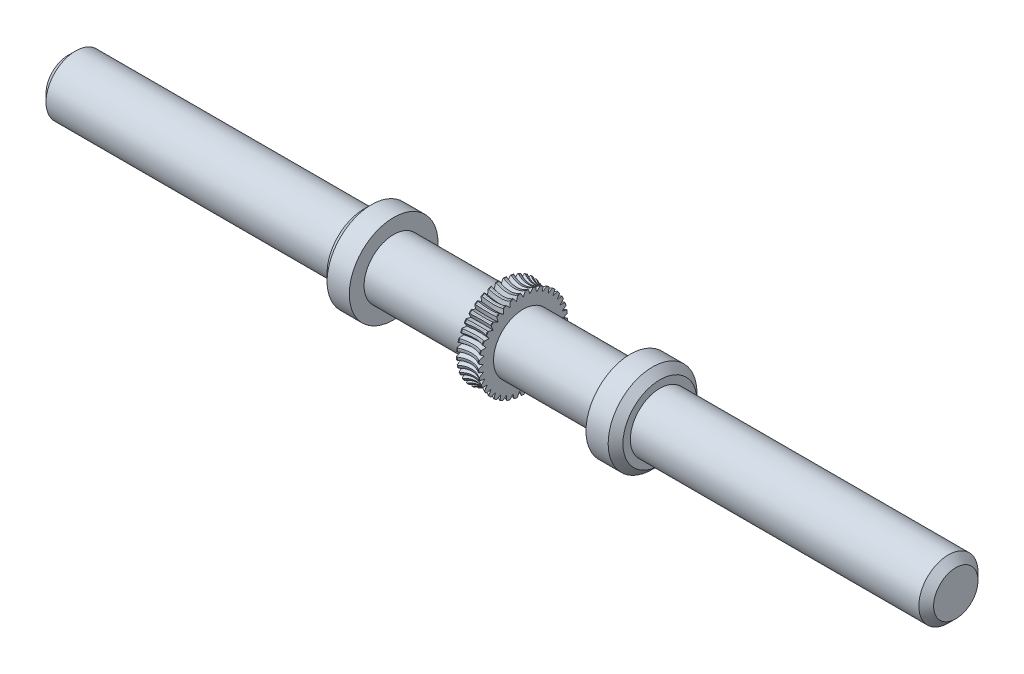
from build123d import *

# Parameters (mm, degrees)
CHAMFER1_SIZE     = 0.5
CIRPATTERN1_COUNT = 37
SKETCH3_W         = 7.25
SKETCH3_H         = 1


with BuildPart() as part:
    # Sketch1 → Revolve1 (revolve)
    with BuildSketch(Plane.XY):
        Polygon((-10, 3), (10, 3), (10, 2), (30, 2), (30, 0), (-30, 0), (-30, 2), (-10, 2), align=None)
    revolve(axis=Axis((0, 0, 0), (1, 0, 0)))

    # Chamfer1
    chamfer1_edges = [part.edges().sort_by_distance(p)[0] for p in [
        (30, -2, 0),
        (10, -3, 0),
        (-10, -3, 0),
        (-30, -2, 0),
    ]]
    chamfer(chamfer1_edges, length=CHAMFER1_SIZE)

    # Sketch2 → Cut-Revolve1 (revolve, cut)
    with BuildSketch(Plane(origin=(0, 0, 0), x_dir=(0, 0, -1), z_dir=(1, 0, 0))):
        Polygon((0.156173248, 2.7705), (0, 2.5), (-0.156173248, 2.7705), (-1.150795268, 2.7705), (-1.150795268, 4), (1.150795268, 4), (1.150795268, 2.7705), align=None)
    cut_revolve1 = revolve(axis=Axis((0, 4, -9.989903303), (0, 0, 1)), mode=Mode.SUBTRACT)

    # CirPattern1: Cut-Revolve1 ×37 about axis
    cirpattern1_axis = Axis((0, 0, 0), (-1, 0, 0))
    for i in range(1, CIRPATTERN1_COUNT):
        add(cut_revolve1.rotate(cirpattern1_axis, i * 360 / CIRPATTERN1_COUNT), mode=Mode.SUBTRACT)

    # Sketch3 → Cut-Revolve2 (revolve, cut)
    with BuildSketch(Plane.XY):
        with Locations((4.375, 2.5)):
            Rectangle(SKETCH3_W, SKETCH3_H)
        with Locations((-4.375, 2.5)):
            Rectangle(SKETCH3_W, SKETCH3_H)
    revolve(axis=Axis((0, 0, 0), (-1, 0, 0)), mode=Mode.SUBTRACT)


solid = part.part
